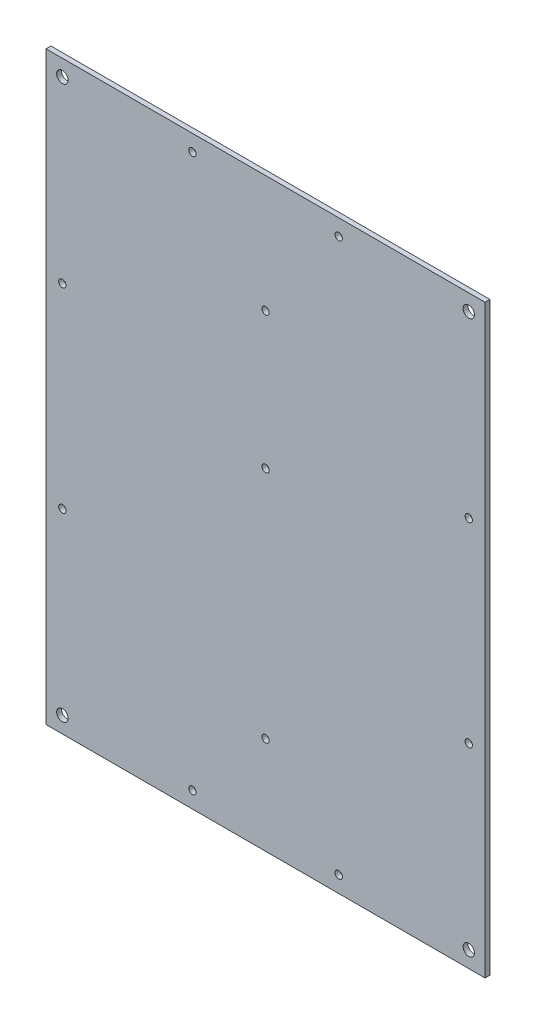
from build123d import *

# Parameters (mm, degrees)
SKETCH_1_W          = 270
SKETCH_1_H          = 360
SKETCH_1_R          = 2.25
EXTRUDE_1_DEPTH     = 3
SKETCH_2_R          = 3.5
CUT_EXTRUDE_1_DEPTH = 451.009999889
SKETCH1_R           = 2.25
CUT_EXTRUDE1_DEPTH  = 451.009999889


with BuildPart() as part:
    # Эскиз1 → Бобышка-Вытянуть1 (new body)
    with BuildSketch(Plane.XY):
        with Locations((135, 180)):
            Rectangle(SKETCH_1_W, SKETCH_1_H)
        with Locations((90, 10)):
            Circle(SKETCH_1_R, mode=Mode.SUBTRACT)
        with Locations((90, 350)):
            Circle(SKETCH_1_R, mode=Mode.SUBTRACT)
        with Locations((180, 350)):
            Circle(SKETCH_1_R, mode=Mode.SUBTRACT)
        with Locations((180, 10)):
            Circle(SKETCH_1_R, mode=Mode.SUBTRACT)
        with Locations((10, 240)):
            Circle(SKETCH_1_R, mode=Mode.SUBTRACT)
        with Locations((10, 120)):
            Circle(SKETCH_1_R, mode=Mode.SUBTRACT)
        with Locations((260, 240)):
            Circle(SKETCH_1_R, mode=Mode.SUBTRACT)
        with Locations((260, 120)):
            Circle(SKETCH_1_R, mode=Mode.SUBTRACT)
    extrude(amount=EXTRUDE_1_DEPTH)

    # Эскиз2 → Вырез-Вытянуть1 (cut, through all)
    with BuildSketch(Plane.XY.offset(3)):
        with Locations((10, 350)):
            Circle(SKETCH_2_R)
        with Locations((260, 350)):
            Circle(SKETCH_2_R)
        with Locations((260, 10)):
            Circle(SKETCH_2_R)
        with Locations((10, 10)):
            Circle(SKETCH_2_R)
    extrude(amount=-CUT_EXTRUDE_1_DEPTH, mode=Mode.SUBTRACT)

    # Sketch1 → Cut-Extrude1 (cut, through all)
    with BuildSketch(Plane(origin=(0, 0, 0), x_dir=(-1, 0, 0), z_dir=(0, 0, -1))):
        with Locations((-135, 60)):
            Circle(SKETCH1_R)
        with Locations((-135, 204)):
            Circle(SKETCH1_R)
        with Locations((-135, 288)):
            Circle(SKETCH1_R)
    extrude(amount=-CUT_EXTRUDE1_DEPTH, mode=Mode.SUBTRACT)


solid = part.part
